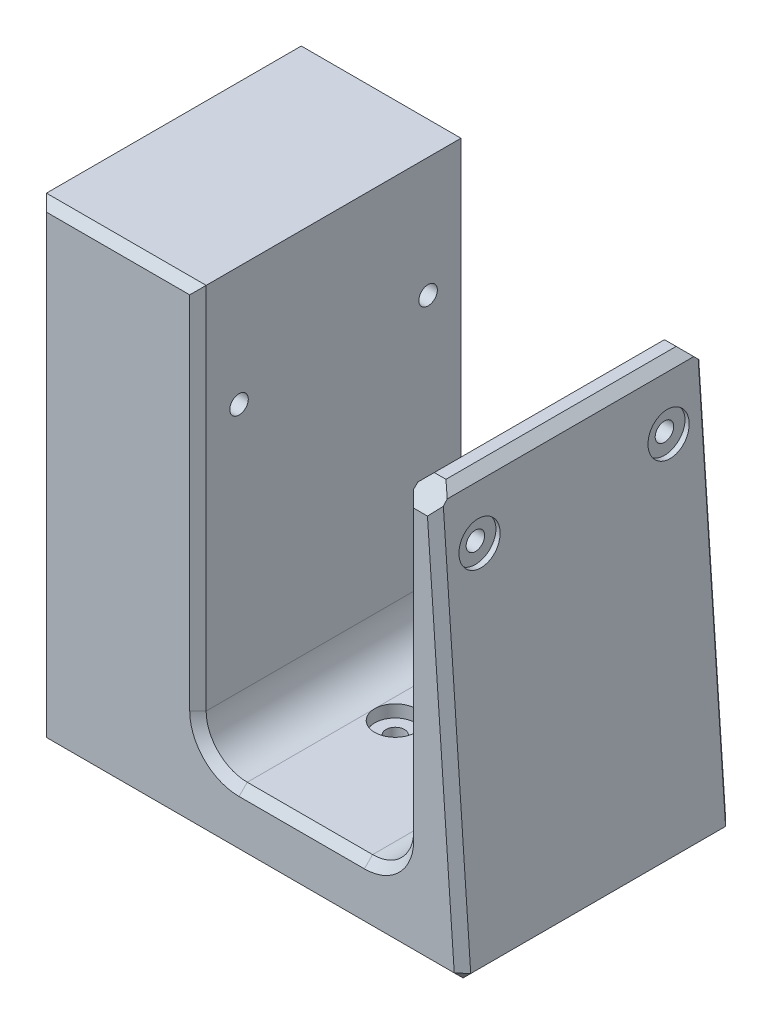
from build123d import *
from OCP.BRepFilletAPI import BRepFilletAPI_MakeChamfer

# Parameters (mm, degrees)
ESTRUSIONE_ESTRUSIONE1_DEPTH                         = 66
RACCORDO1_R                                          = 10
SMUSSO1_SIZE                                         = 2
SMUSSO1_SIZE2                                        = 2.155800013
SMUSSO1_SIZE2_2                                      = 1.873732722
SMUSSO2_SIZE                                         = 5
FORO_LAMATO_PER_VITE_M4_A_TESTA_CILINDRI_D           = 4.5
FORO_LAMATO_PER_VITE_M4_A_TESTA_CILINDRI_DEPTH       = 30
FORO_LAMATO_PER_VITE_M4_A_TESTA_CILINDRI_CBORE_D     = 10
FORO_LAMATO_PER_VITE_M4_A_TESTA_CILINDRI_CBORE_DEPTH = 3
FORO_LAMATO_PER_VITE_M4_A_TESTA_CILINDRI_TIP         = 1.351936393
FORO_LAMATO_PER_VITE_M4_A_TESTA_CILI_2_D             = 4.5
FORO_LAMATO_PER_VITE_M4_A_TESTA_CILI_2_DEPTH         = 30
FORO_LAMATO_PER_VITE_M4_A_TESTA_CILI_2_CBORE_D       = 10
FORO_LAMATO_PER_VITE_M4_A_TESTA_CILI_2_CBORE_DEPTH   = 3
FORO_LAMATO_PER_VITE_M4_A_TESTA_CILI_2_TIP           = 1.351936393
FORO_LAMATO_PER_VITE_M4_A_TESTA_CILI_3_D             = 4.5
FORO_LAMATO_PER_VITE_M4_A_TESTA_CILI_3_DEPTH         = 45
FORO_LAMATO_PER_VITE_M4_A_TESTA_CILI_3_CBORE_D       = 10
FORO_LAMATO_PER_VITE_M4_A_TESTA_CILI_3_CBORE_DEPTH   = 32
FORO_LAMATO_PER_VITE_M4_A_TESTA_CILI_3_TIP           = 1.351936393


with BuildPart() as part:
    # Schizzo1 → Estrusione-Estrusione1 (new body)
    with BuildSketch(Plane.XY):
        Polygon((25.25, 100), (32.25, 100), (39.25, 0), (-39.25, 0), (-64.110342, 0), (-64.110342, 114.69), (-25.25, 114.69), (-25.25, 100), (-25.25, 15), (25.25, 15), align=None)
    extrude(amount=ESTRUSIONE_ESTRUSIONE1_DEPTH)

    # Raccordo1
    raccordo1_edges = [part.edges().sort_by_distance(p)[0] for p in [
        (-25.25, 15, 33),
        (25.25, 15, 33),
    ]]
    fillet(raccordo1_edges, radius=RACCORDO1_R)

    # Smusso1: one chamfer whose edges measure the first distance from different faces: ONE call of the kernel's chamfer builder (chamfer() names one face for all edges)
    smusso1_edges_1 = [part.edges().sort_by_distance(p)[0] for p in [
        (35.75, 50, 0),
        (-12.430171, 0, 0),
        (-64.110342, 57.345, 0),
        (-44.680171, 114.69, 0),
        (25.25, 62.5, 0),
        (25.25, 100, 33),
        (-44.680171, 114.69, 66),
        (-64.110342, 57.345, 66),
        (-12.430171, 0, 66),
        (-25.25, 69.845, 0),
        (-25.25, 69.845, 66),
        (0, 15, 0),
        (0, 15, 66),
        (-22.321067812, 17.928932188, 0),
        (-22.321067812, 17.928932188, 66),
        (35.75, 50, 66),
        (22.321067812, 17.928932188, 0),
        (22.321067812, 17.928932188, 66),
        (25.25, 62.5, 66),
    ]]
    smusso1_edges_2 = [part.edges().sort_by_distance(p)[0] for p in [
        (32.25, 100, 33),
    ]]
    smusso1_side_2 = [part.faces().sort_by_distance(p)[0] for p in [
        (35.75, 50, 33),
    ]]
    smusso1_edges_3 = [part.edges().sort_by_distance(p)[0] for p in [
        (39.25, 0, 33),
    ]]
    smusso1_side_3 = [part.faces().sort_by_distance(p)[0] for p in [
        (-12.430171, 0, 33),
    ]]
    smusso1 = BRepFilletAPI_MakeChamfer(part.part.solid().wrapped)
    for e in smusso1_edges_1:
        smusso1.Add(SMUSSO1_SIZE, e.wrapped)
    for e in smusso1_edges_2:
        smusso1.Add(SMUSSO1_SIZE, SMUSSO1_SIZE2, e.wrapped, smusso1_side_2[0].wrapped)  # the first distance lies on this face
    for e in smusso1_edges_3:
        smusso1.Add(SMUSSO1_SIZE, SMUSSO1_SIZE2_2, e.wrapped, smusso1_side_3[0].wrapped)  # the first distance lies on this face
    add(Compound.cast(smusso1.Shape()), mode=Mode.REPLACE)

    # Smusso2
    # the kernel refuses this chamfer: 5 mm, written as the material it takes off along each edge
    with BuildSketch(Plane(origin=(14.39158506, 100, 66), x_dir=(2.02935454733688e-15, -0.9996219169112968, 0.027495876610587663), z_dir=(1, 0, 0)), Plane(origin=(14.39158506, 100, 0), x_dir=(0, 0.0274958766105877, 0.9996219169112968), z_dir=(1, 0, 0))) as smusso2_piece_1:
        Polygon((SMUSSO2_SIZE * 0.999621916911, SMUSSO2_SIZE * 0.0274958766106), (-SMUSSO2_SIZE * 0.0274958766106, SMUSSO2_SIZE * 0.999621916911), (0, 0), align=None)
    extrude(amount=28.561029867, mode=Mode.SUBTRACT)

    # Foro lamato per Vite M4 a testa cilindri
    with Locations(Plane(origin=(35.25, 0, 0), x_dir=(0, 0, 1), z_dir=(1, 0, 0))):
        with Locations((56, -85.613628), (10, -85.613628)):
            CounterBoreHole(FORO_LAMATO_PER_VITE_M4_A_TESTA_CILINDRI_D / 2, FORO_LAMATO_PER_VITE_M4_A_TESTA_CILINDRI_CBORE_D / 2, FORO_LAMATO_PER_VITE_M4_A_TESTA_CILINDRI_CBORE_DEPTH, depth=FORO_LAMATO_PER_VITE_M4_A_TESTA_CILINDRI_DEPTH)
            with Locations((0, 0, -(FORO_LAMATO_PER_VITE_M4_A_TESTA_CILINDRI_DEPTH + FORO_LAMATO_PER_VITE_M4_A_TESTA_CILINDRI_TIP / 2))):  # 118° drill point
                Cone(0, FORO_LAMATO_PER_VITE_M4_A_TESTA_CILINDRI_D / 2, FORO_LAMATO_PER_VITE_M4_A_TESTA_CILINDRI_TIP, mode=Mode.SUBTRACT)

    # Foro lamato per Vite M4 a testa cili 2
    with Locations(Plane(origin=(0, 15, 0), x_dir=(1, 0, 0), z_dir=(0, 1, 0))):
        with Locations((-10.245584981, -33), (9.754415019, -33)):
            CounterBoreHole(FORO_LAMATO_PER_VITE_M4_A_TESTA_CILI_2_D / 2, FORO_LAMATO_PER_VITE_M4_A_TESTA_CILI_2_CBORE_D / 2, FORO_LAMATO_PER_VITE_M4_A_TESTA_CILI_2_CBORE_DEPTH, depth=FORO_LAMATO_PER_VITE_M4_A_TESTA_CILI_2_DEPTH)
            with Locations((0, 0, -(FORO_LAMATO_PER_VITE_M4_A_TESTA_CILI_2_DEPTH + FORO_LAMATO_PER_VITE_M4_A_TESTA_CILI_2_TIP / 2))):  # 118° drill point
                Cone(0, FORO_LAMATO_PER_VITE_M4_A_TESTA_CILI_2_D / 2, FORO_LAMATO_PER_VITE_M4_A_TESTA_CILI_2_TIP, mode=Mode.SUBTRACT)

    # Foro lamato per Vite M4 a testa cili 3
    with Locations(Plane.ZY.offset(64.110342)):
        with Locations((10, 85.613628), (56, 85.613628)):
            CounterBoreHole(FORO_LAMATO_PER_VITE_M4_A_TESTA_CILI_3_D / 2, FORO_LAMATO_PER_VITE_M4_A_TESTA_CILI_3_CBORE_D / 2, FORO_LAMATO_PER_VITE_M4_A_TESTA_CILI_3_CBORE_DEPTH, depth=FORO_LAMATO_PER_VITE_M4_A_TESTA_CILI_3_DEPTH)
            with Locations((0, 0, -(FORO_LAMATO_PER_VITE_M4_A_TESTA_CILI_3_DEPTH + FORO_LAMATO_PER_VITE_M4_A_TESTA_CILI_3_TIP / 2))):  # 118° drill point
                Cone(0, FORO_LAMATO_PER_VITE_M4_A_TESTA_CILI_3_D / 2, FORO_LAMATO_PER_VITE_M4_A_TESTA_CILI_3_TIP, mode=Mode.SUBTRACT)


solid = part.part
